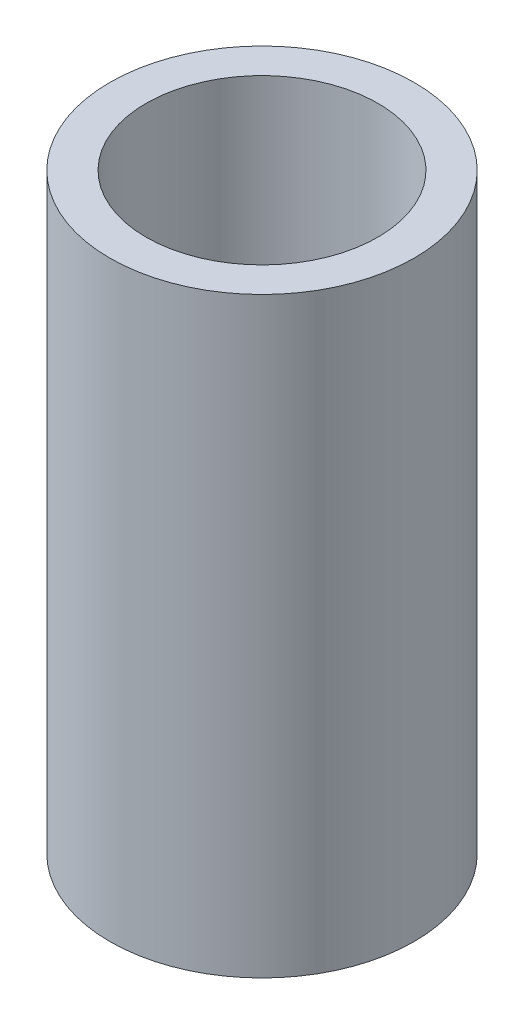
from build123d import *

# Parameters (mm, degrees)
SKETCH1_R           = 40
BOSS_EXTRUDE1_DEPTH = 155.587785413
SKETCH2_R           = 30.480576835
CUT_EXTRUDE1_DEPTH  = 166.552284701


with BuildPart() as part:
    # Sketch1 → Boss-Extrude1 (new body)
    with BuildSketch(Plane(origin=(0, 0, 0), x_dir=(1, 0, 0), z_dir=(0, 1, 0))):
        Circle(SKETCH1_R)
    extrude(amount=BOSS_EXTRUDE1_DEPTH)

    # Sketch2 → Cut-Extrude1 (cut, through all)
    with BuildSketch(Plane(origin=(0, 0, 0), x_dir=(1, 0, 0), z_dir=(0, 1, 0))):
        Circle(SKETCH2_R)
    extrude(amount=CUT_EXTRUDE1_DEPTH, mode=Mode.SUBTRACT)


solid = part.part
